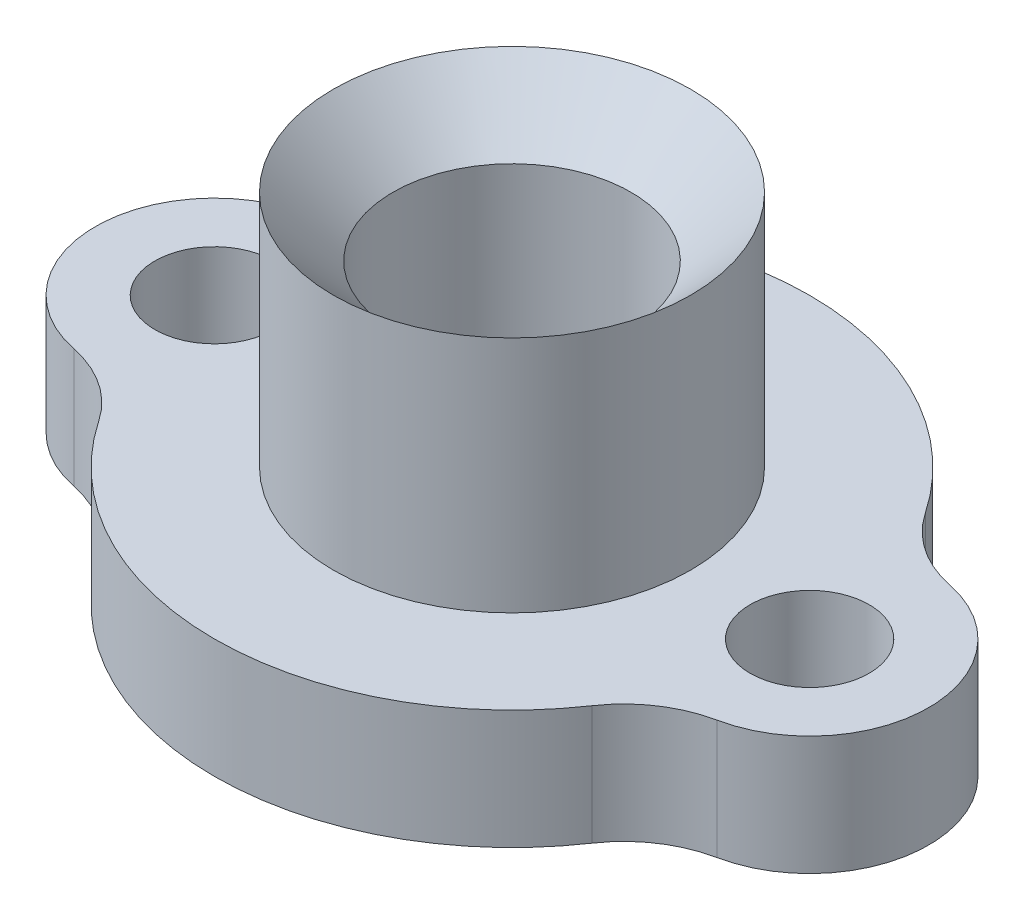
from build123d import *

# Parameters (mm, degrees)
SKETCH1_R           = 5
BOSS_EXTRUDE1_DEPTH = 10
SKETCH2_R           = 15
SKETCH2_R_2         = 10
BOSS_EXTRUDE2_DEPTH = 25
CHAMFER2_SIZE       = 10


with BuildPart() as part:
    # Sketch1 → Boss-Extrude1 (new body)
    with BuildSketch(Plane(origin=(0, 0, 0), x_dir=(1, 0, 0), z_dir=(0, 1, 0))):
        with BuildLine():
            ThreePointArc((-20.714285714, -13.997084244), (0, -25), (20.714285714, -13.997084244))
            ThreePointArc((20.714285714, -13.997084244), (23.445079401, -11.280699536), (27, -9.797958971))
            ThreePointArc((27, -9.797958971), (35, 0), (27, 9.797958971))
            ThreePointArc((27, 9.797958971), (23.445079401, 11.280699536), (20.714285714, 13.997084244))
            ThreePointArc((20.714285714, 13.997084244), (0, 25), (-20.714285714, 13.997084244))
            ThreePointArc((-20.714285714, 13.997084244), (-23.445079401, 11.280699536), (-27, 9.797958971))
            ThreePointArc((-27, 9.797958971), (-35, 0), (-27, -9.797958971))
            ThreePointArc((-27, -9.797958971), (-23.445079401, -11.280699536), (-20.714285714, -13.997084244))
        make_face()
        with Locations(Location((25, 0, 0), (0, 0, 270))):
            Circle(SKETCH1_R, mode=Mode.SUBTRACT)
        with Locations(Location((-25, 0, 0), (0, 0, 90))):
            Circle(SKETCH1_R, mode=Mode.SUBTRACT)
    extrude(amount=BOSS_EXTRUDE1_DEPTH)

    # Sketch2 → Boss-Extrude2 (add)
    with BuildSketch(Plane(origin=(0, 10, 0), x_dir=(1, 0, 0), z_dir=(0, 1, 0))):
        with Locations(Location((0, 0, 0), (0, 0, 270))):
            Circle(SKETCH2_R)
        with Locations(Location((0, 0, 0), (0, 0, 270))):
            Circle(SKETCH2_R_2, mode=Mode.SUBTRACT)
    extrude(amount=BOSS_EXTRUDE2_DEPTH)

    # Chamfer2
    # the kernel refuses this chamfer: 10 mm, written as the material it takes off along each edge
    with BuildSketch(Plane(origin=(0, 35, 0), x_dir=(0, 0, 1), z_dir=(-1, 0, 0))) as chamfer2_piece_1:
        Polygon((10 + CHAMFER2_SIZE, 0), (10, -CHAMFER2_SIZE), (10, 0), align=None)
    revolve(axis=Axis((0, 35, 0), (0, 1, 0)), mode=Mode.SUBTRACT)


solid = part.part
